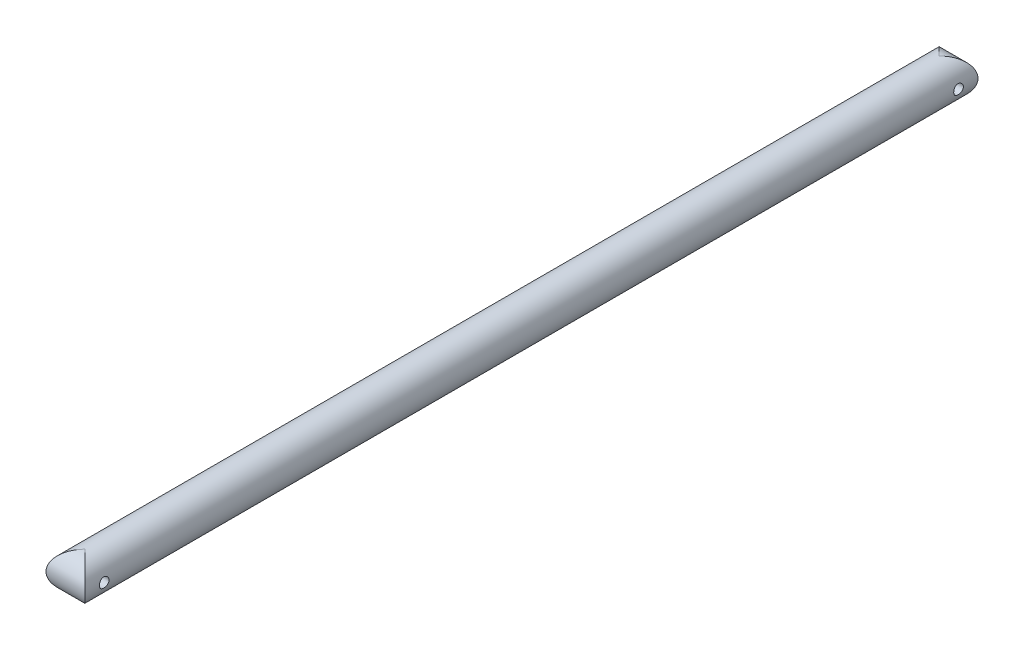
from build123d import *

# Parameters (mm, degrees)
SKETCH1_R              = 12.7
BOSS_EXTRUDE1_DEPTH    = 292.1
CUT_EXTRUDE2_START     = -12.700000102
CUT_EXTRUDE2_OUTLINE_R = 3.175
CUT_EXTRUDE2_DEPTH     = 25.400000102


# Read off the part's stored shape, not the designer's step: Cut-Extrude2
with BuildPart() as part:
    # Sketch1 → Boss-Extrude1 (new, symmetric)
    with BuildSketch(Plane.XY):
        Circle(SKETCH1_R)
    extrude(amount=BOSS_EXTRUDE1_DEPTH, both=True)

    # Cut-Extrude2 outline → Cut-Extrude2 (cut)
    with BuildSketch(Plane(origin=(0, 0, 0), x_dir=(0, 0, -1), z_dir=(1, 0, 0)).offset(CUT_EXTRUDE2_START)):
        with BuildLine():
            ThreePointArc((-292.1, 3.2e-08), (-288.38025611, 8.980256132), (-279.4, 12.7))
            Line((-279.4, 12.7), (-292.1, 12.7))
            Line((-292.1, 12.7), (-292.1, 3.2e-08))
        make_face()
        with BuildLine():
            Line((292.1, 12.7), (279.4, 12.7))
            ThreePointArc((279.4, 12.7), (288.38025611, 8.980256132), (292.1, 3.2e-08))
            Line((292.1, 3.2e-08), (292.1, 12.7))
        make_face()
        with BuildLine():
            ThreePointArc((-279.4, -12.7), (-288.380256132, -8.98025611), (-292.1, 3.2e-08))
            Line((-292.1, 3.2e-08), (-292.1, -12.7))
            Line((-292.1, -12.7), (-279.4, -12.7))
        make_face()
        with BuildLine():
            Line((292.1, -12.7), (292.1, 3.2e-08))
            ThreePointArc((292.1, 3.2e-08), (288.380256132, -8.98025611), (279.4, -12.7))
            Line((279.4, -12.7), (292.1, -12.7))
        make_face()
        with Locations((-279.4, 0)):
            Circle(CUT_EXTRUDE2_OUTLINE_R)
        with Locations((279.4, 0)):
            Circle(CUT_EXTRUDE2_OUTLINE_R)
    extrude(amount=CUT_EXTRUDE2_DEPTH, mode=Mode.SUBTRACT)


solid = part.part
